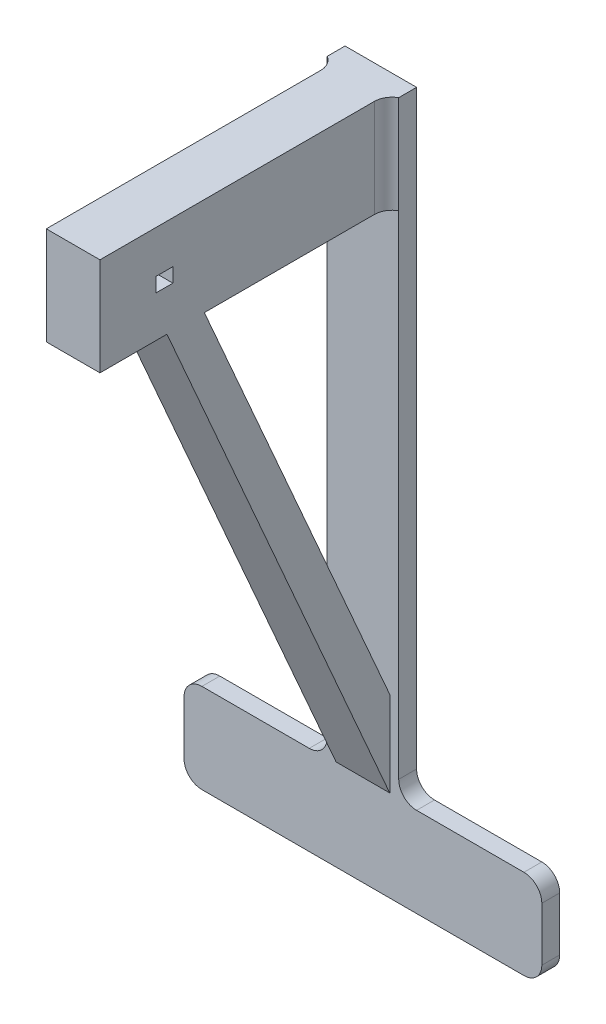
from build123d import *

# Parameters (mm, degrees)
SKETCH_1_W          = 100
SKETCH_1_H          = 25
EXTRUDE_1_DEPTH     = 5
SKETCH_2_W          = 20
SKETCH_2_H          = 5
EXTRUDE_2_DEPTH     = 170
SKETCH_3_W          = 15
SKETCH_3_H          = 27.372730927
EXTRUDE_3_DEPTH     = 81
FILLET_1_R          = 5
SKETCH_6_W          = 15
SKETCH_6_H          = 23.851489588
FILLET_2_R          = 5
FILLET_3_R          = 5
SKETCH_5_W          = 4.727272728
SKETCH_5_H          = 4
CUT_EXTRUDE_3_DEPTH = 100


with BuildPart() as part:
    # 草图1 → 凸台-拉伸1 (new body)
    with BuildSketch(Plane.XY):
        Rectangle(SKETCH_1_W, SKETCH_1_H)
    extrude(amount=EXTRUDE_1_DEPTH)

    # 草图2 → 凸台-拉伸2 (add)
    with BuildSketch(Plane(origin=(0, 12.5, 0), x_dir=(1, 0, 0), z_dir=(0, 1, 0))):
        with Locations((0, -2.5)):
            Rectangle(SKETCH_2_W, SKETCH_2_H)
    extrude(amount=EXTRUDE_2_DEPTH)

    # 草图3 → 凸台-拉伸3 (add)
    with BuildSketch(Plane.XY.offset(5)):
        with Locations((0, 168.813634536)):
            Rectangle(SKETCH_3_W, SKETCH_3_H)
    extrude(amount=EXTRUDE_3_DEPTH)

    # 圆角1
    # the kernel refuses this fillet: 5 mm, written as the material it adds along each edge
    with BuildSketch(Plane(origin=(-7.5, 155.127269073, 5), x_dir=(-1, 0, 0), z_dir=(0, 1, 0)), Plane(origin=(7.5, 182.5, 5), x_dir=(1, 0, 0), z_dir=(0, -1, 0))) as fillet_1_piece_1:
        with BuildLine():
            CenterArc((5, 4.330127019), FILLET_1_R, 180, 60)
            Line((0, 4.330127019), (-0.1, 4.330127019))
            Line((-0.1, 4.330127019), (-0.1, 0))
            Line((-0.1, 0), (0, -0.1))
            ThreePointArc((0, -0.1), (1.25, -0.1), (2.45, -0.08660254))
            Line((2.45, -0.08660254), (2.5, 0))
        make_face()
    extrude(amount=27.372730927)

    # 扫描1: sweep along a path in 草图7
    with BuildLine(Plane(origin=(0, 0, 0), x_dir=(0, 0, -1), z_dir=(1, 0, 0))) as sweep_1_path:
        Line((-5, 24.875224673), (-67.976637777, 168.654354293))
    # 草图6 → 扫描1 (sweep)
    with BuildSketch(Plane.XY.offset(5)):
        with Locations((0, 24.875224673)):
            Rectangle(SKETCH_6_W, SKETCH_6_H)
    sweep(path=sweep_1_path.line)

    # 圆角2
    fillet_2_edges = [part.edges().sort_by_distance(p)[0] for p in [
        (-10, 12.5, 2.5),
        (10, 12.5, 2.5),
    ]]
    fillet(fillet_2_edges, radius=FILLET_2_R)

    # 圆角3
    fillet_3_edges = [part.edges().sort_by_distance(p)[0] for p in [
        (-50, 12.5, 2.5),
        (50, 12.5, 2.5),
        (50, -12.5, 2.5),
        (-50, -12.5, 2.5),
    ]]
    fillet(fillet_3_edges, radius=FILLET_3_R)

    # 草图5 → 切除-拉伸3 (cut)
    with BuildSketch(Plane(origin=(7.5, 0, 0), x_dir=(0, 0, -1), z_dir=(1, 0, 0))):
        with Locations((-67.976637777, 168.654354293)):
            Rectangle(SKETCH_5_W, SKETCH_5_H)
    extrude(amount=-CUT_EXTRUDE_3_DEPTH, mode=Mode.SUBTRACT)


solid = part.part
